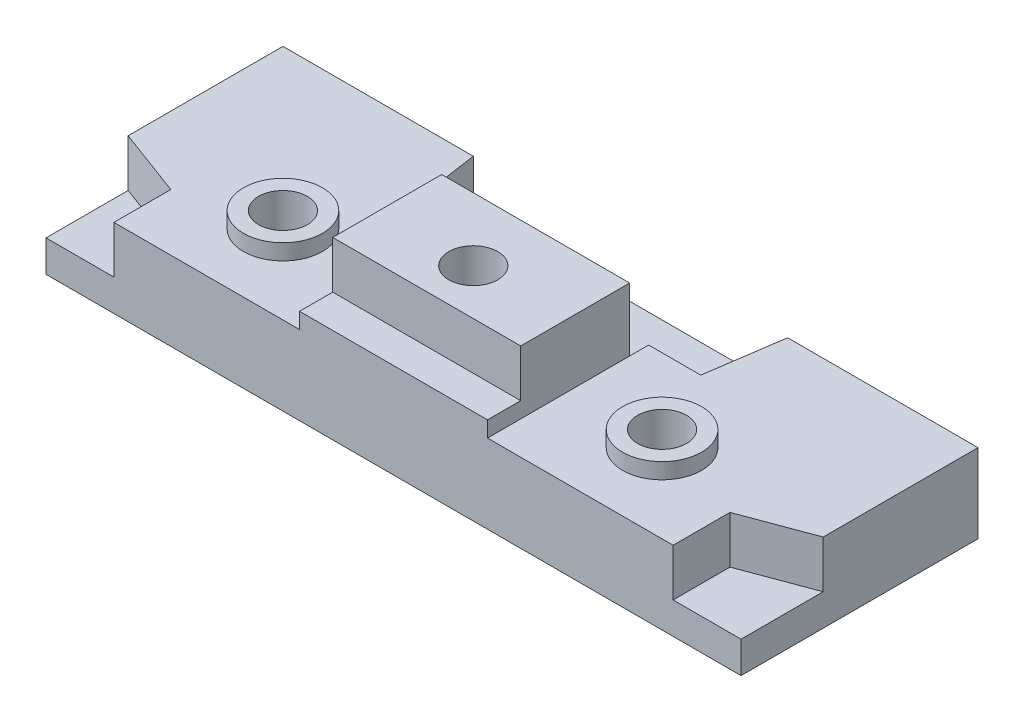
from build123d import *

# Parameters (mm, degrees)
SKETCH1_W           = 44
SKETCH1_H           = 15
BOSS_EXTRUDE1_DEPTH = 5
SKETCH2_W           = 11.9
SKETCH2_H           = 15
BOSS_EXTRUDE2_DEPTH = 4
SKETCH3_R           = 1.55
CUT_EXTRUDE1_DEPTH  = 3
SKETCH4_R           = 1.55
CUT_EXTRUDE2_DEPTH  = 3
BOSS_EXTRUDE3_START = 1
SKETCH5_R           = 2.5
SKETCH5_R_2         = 1.55
BOSS_EXTRUDE3_DEPTH = 1
CUT_EXTRUDE3_DEPTH  = 3
SKETCH7_W           = 11.9
SKETCH7_H           = 6
CUT_EXTRUDE4_DEPTH  = 7
SKETCH8_W           = 11.9
SKETCH8_H           = 2.1
CUT_EXTRUDE5_DEPTH  = 3


with BuildPart() as part:
    # Sketch1 → Boss-Extrude1 (new body)
    with BuildSketch(Plane(origin=(0, 0, 0), x_dir=(1, 0, 0), z_dir=(0, 1, 0))):
        with Locations((22, -7.5)):
            Rectangle(SKETCH1_W, SKETCH1_H)
    extrude(amount=BOSS_EXTRUDE1_DEPTH)

    # Sketch2 → Boss-Extrude2 (add)
    with BuildSketch(Plane(origin=(0, 5, 0), x_dir=(1, 0, 0), z_dir=(0, 1, 0))):
        with Locations((22, -7.5)):
            Rectangle(SKETCH2_W, SKETCH2_H)
    extrude(amount=BOSS_EXTRUDE2_DEPTH)

    # Sketch3 → Cut-Extrude1 (cut)
    with BuildSketch(Plane(origin=(0, 5, 0), x_dir=(1, 0, 0), z_dir=(0, 1, 0))):
        with Locations((10, -10)):
            Circle(SKETCH3_R)
        with Locations((34, -10)):
            Circle(SKETCH3_R)
    extrude(amount=-CUT_EXTRUDE1_DEPTH, mode=Mode.SUBTRACT)

    # Sketch4 → Cut-Extrude2 (cut)
    with BuildSketch(Plane(origin=(0, 9, 0), x_dir=(1, 0, 0), z_dir=(0, 1, 0))):
        with Locations((22.05, -10)):
            Circle(SKETCH4_R)
    extrude(amount=-CUT_EXTRUDE2_DEPTH, mode=Mode.SUBTRACT)

    # Sketch5 → Boss-Extrude3 (add)
    # profile 1 of 2: a face of its own
    with BuildSketch(Plane(origin=(0, 5, 0), x_dir=(1, 0, 0), z_dir=(0, 1, 0)).offset(BOSS_EXTRUDE3_START)):
        with Locations((10, -10)):
            Circle(SKETCH5_R)
        with Locations((10, -10)):
            Circle(SKETCH5_R_2, mode=Mode.SUBTRACT)
    # profile 2 of 2: a face of its own
    with BuildSketch(Plane(origin=(0, 5, 0), x_dir=(1, 0, 0), z_dir=(0, 1, 0)).offset(BOSS_EXTRUDE3_START)):
        with Locations((34, -10)):
            Circle(SKETCH5_R)
        with Locations((34, -10)):
            Circle(SKETCH5_R_2, mode=Mode.SUBTRACT)
    extrude(amount=-BOSS_EXTRUDE3_DEPTH)

    # Sketch6 → Cut-Extrude3 (cut)
    with BuildSketch(Plane(origin=(0, 5, 0), x_dir=(1, 0, 0), z_dir=(0, 1, 0))):
        Polygon((16.05, -4.8), (12.75, -4.8), (12.05, 0), (16.05, 0), align=None)
        Polygon((0, -15), (4.3, -15), (4.3, -11.4), (0, -9.8), align=None)
        Polygon((39.7, -11.4), (44, -9.8), (44, -15), (39.7, -15), align=None)
        Polygon((31.95, 0), (27.95, 0), (27.95, -4.8), (31.25, -4.8), align=None)
    extrude(amount=-CUT_EXTRUDE3_DEPTH, mode=Mode.SUBTRACT)

    # Sketch7 → Cut-Extrude4 (cut)
    with BuildSketch(Plane(origin=(0, 9, 0), x_dir=(1, 0, 0), z_dir=(0, 1, 0))):
        with Locations((22, -3)):
            Rectangle(SKETCH7_W, SKETCH7_H)
    extrude(amount=-CUT_EXTRUDE4_DEPTH, mode=Mode.SUBTRACT)

    # Sketch8 → Cut-Extrude5 (cut)
    with BuildSketch(Plane(origin=(0, 9, 0), x_dir=(1, 0, 0), z_dir=(0, 1, 0))):
        with Locations((22, -13.95)):
            Rectangle(SKETCH8_W, SKETCH8_H)
    extrude(amount=-CUT_EXTRUDE5_DEPTH, mode=Mode.SUBTRACT)


solid = part.part
